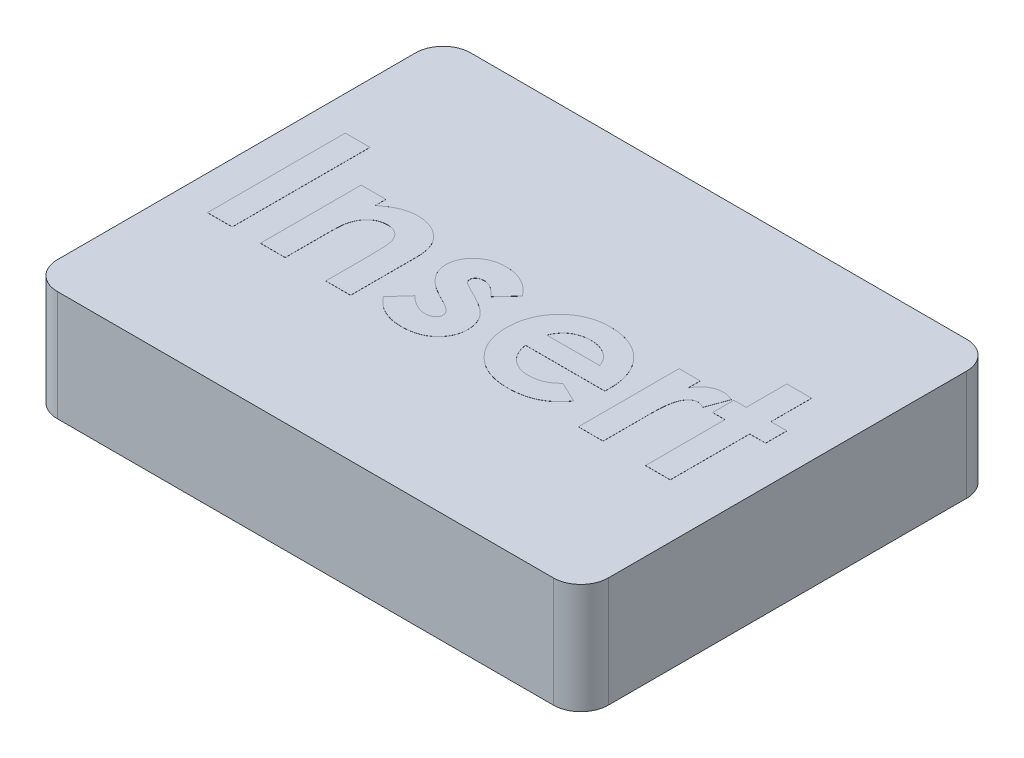
from build123d import *

# Parameters (mm, degrees)
SKETCH1_W           = 12.7
SKETCH1_H           = 9.525
BOSS_EXTRUDE1_DEPTH = 2.54
FILLET1_R           = 0.635
SHELL1_START        = 0.635
SHELL1_OUTLINE_W    = 1.905
SHELL1_OUTLINE_H    = 8.255
SHELL1_DEPTH        = 11.43
SKETCH2_R           = 2.54
BOSS_EXTRUDE2_DEPTH = 1.905
SKETCH3_W           = 0.569871795
SKETCH3_H           = 3.175
BOSS_EXTRUDE3_DEPTH = 0.00254


# Read off the part's stored shape, not the designer's step: Shell1
with BuildPart() as part:
    # Sketch1 → Boss-Extrude1 (new body)
    with BuildSketch(Plane(origin=(0, 0, 0), x_dir=(1, 0, 0), z_dir=(0, 1, 0))):
        with Locations((6.35, 4.7625)):
            Rectangle(SKETCH1_W, SKETCH1_H)
    extrude(amount=BOSS_EXTRUDE1_DEPTH)

    # Fillet1
    fillet1_edges = [part.edges().sort_by_distance(p)[0] for p in [
        (0, 1.27, -9.525),
        (12.7, 1.27, -9.525),
        (12.7, 1.27, 0),
        (0, 1.27, 0),
    ]]
    fillet(fillet1_edges, radius=FILLET1_R)

    # Shell1 outline → Shell1 (cut)
    with BuildSketch(Plane.YZ.offset(SHELL1_START)):
        with Locations((0.9525, -4.7625)):
            Rectangle(SHELL1_OUTLINE_W, SHELL1_OUTLINE_H)
    extrude(amount=SHELL1_DEPTH, mode=Mode.SUBTRACT)

    # Sketch2 → Boss-Extrude2 (add)
    with BuildSketch(Plane(origin=(0, 1.905, 0), x_dir=(-1, 0, 0), z_dir=(0, -1, 0))):
        with Locations(Location((-6.35, 4.7625, 0), (0, 0, 270))):
            Circle(SKETCH2_R)
    extrude(amount=BOSS_EXTRUDE2_DEPTH)

    # Sketch3 → Boss-Extrude3 (add)
    # profile 1 of 6: a face of its own
    with BuildSketch(Plane(origin=(0, 2.54, 0), x_dir=(1, 0, 0), z_dir=(0, 1, 0))):
        with Locations((1.077871795, 4.8895)):
            Rectangle(SKETCH3_W, SKETCH3_H)
    # profile 2 of 6: a face of its own
    with BuildSketch(Plane(origin=(0, 2.54, 0), x_dir=(1, 0, 0), z_dir=(0, 1, 0))):
        with BuildLine():
            Line((2.014089744, 5.622192308), (2.583961538, 5.622192308))
            Line((2.583961538, 5.622192308), (2.583961538, 5.376689503))
            add(Edge.make_bspline(
                [(2.583961538, 5.376689503), (2.616472442, 5.401977153), (2.678607098, 5.450306769), (2.773062504, 5.511927275), (2.862216712, 5.562361185), (2.948057066, 5.600723797), (3.032198654, 5.628324047), (3.11600421, 5.648153181), (3.200721768, 5.66085032), (3.25767253, 5.66221543), (3.286125, 5.662897436)],
                knots=[0, 0, 0, 0, 1.276643801, 2.439914479, 3.493451431, 4.44993799, 5.350072675, 6.235028322, 7.118224225, 8, 8, 8, 8], degree=3))
            add(Edge.make_bspline(
                [(3.286125, 5.662897436), (3.314986202, 5.662118044), (3.371643164, 5.660588033), (3.455067419, 5.649886845), (3.534771193, 5.630396591), (3.61165069, 5.604518806), (3.684923406, 5.570361613), (3.755486979, 5.529805489), (3.821825726, 5.480405385), (3.862680064, 5.442784638), (3.883345553, 5.423754808)],
                knots=[0, 0, 0, 0, 1.048836932, 2.058954983, 3.049370783, 4.026390553, 5.001981509, 5.982488534, 6.97947532, 8, 8, 8, 8], degree=3))
            add(Edge.make_bspline(
                [(3.883345553, 5.423754808), (3.899920035, 5.40611972), (3.933190306, 5.370720476), (3.975056761, 5.310143303), (4.010982889, 5.244103097), (4.040419359, 5.171838062), (4.062171724, 5.092951149), (4.078906115, 5.008395199), (4.088296074, 4.917696762), (4.089455309, 4.855387791), (4.090051282, 4.823354167)],
                knots=[0, 0, 0, 0, 0.889584746, 1.785680191, 2.700364693, 3.65222533, 4.649950538, 5.707241244, 6.821271309, 8, 8, 8, 8], degree=3))
            Line((4.090051282, 4.823354167), (4.090051282, 3.302))
            Line((4.090051282, 3.302), (3.520179487, 3.302))
            Line((3.520179487, 3.302), (3.520179487, 4.309451923))
            add(Edge.make_bspline(
                [(3.520179487, 4.309451923), (3.520058972, 4.34231325), (3.519828027, 4.405285883), (3.518054878, 4.495409185), (3.51459266, 4.57680223), (3.511436939, 4.649613213), (3.505241003, 4.713583603), (3.499653407, 4.769118384), (3.491079784, 4.815713739), (3.479924109, 4.865834035), (3.460443553, 4.919496978), (3.43020094, 4.976039753), (3.391833944, 5.024074101), (3.346909627, 5.063936766), (3.295477603, 5.095471791), (3.238159355, 5.117658645), (3.175262177, 5.131486038), (3.131436162, 5.132963488), (3.108676082, 5.133730769)],
                knots=[0, 0, 0, 0, 1.49886392, 2.872294502, 4.110984203, 5.214877267, 6.195405875, 7.042225351, 7.75923308, 8.355011229, 9.382752534, 10.352059385, 11.267231453, 12.171456522, 13.078624015, 14.003401117, 14.963110155, 16, 16, 16, 16], degree=3))
            add(Edge.make_bspline(
                [(3.108676082, 5.133730769), (3.079075641, 5.132229723), (3.021171423, 5.129293385), (2.937424557, 5.107150715), (2.860504456, 5.069492551), (2.79103962, 5.017381225), (2.729691644, 4.953043335), (2.679163823, 4.876313021), (2.637720631, 4.789042165), (2.619899442, 4.725320264), (2.610674279, 4.692334535)],
                knots=[0, 0, 0, 0, 0.984188326, 1.925263693, 2.85911992, 3.81709677, 4.80007086, 5.801799564, 6.862098548, 8, 8, 8, 8], degree=3))
            add(Edge.make_bspline(
                [(2.610674279, 4.692334535), (2.608381459, 4.681975146), (2.603268011, 4.658871626), (2.599062847, 4.619840753), (2.593213158, 4.573534401), (2.591021423, 4.519114556), (2.587210238, 4.456838765), (2.585800679, 4.386624637), (2.584388599, 4.30860985), (2.584108608, 4.254119486), (2.583961538, 4.225497596)],
                knots=[0, 0, 0, 0, 0.543362196, 1.211806945, 2.009705693, 2.934833164, 4.000995085, 5.207458376, 6.533175157, 8, 8, 8, 8], degree=3))
            Line((2.583961538, 4.225497596), (2.583961538, 3.302))
            Line((2.583961538, 3.302), (2.014089744, 3.302))
            Line((2.014089744, 3.302), (2.014089744, 5.622192308))
        make_face()
    # profile 3 of 6: a face of its own
    with BuildSketch(Plane(origin=(0, 2.54, 0), x_dir=(1, 0, 0), z_dir=(0, 1, 0))):
        with BuildLine():
            Line((6.084602564, 5.264114383), (5.736064904, 4.8895))
            add(Edge.make_bspline(
                [(5.736064904, 4.8895), (5.718660749, 4.908758641), (5.685373193, 4.945593127), (5.634413162, 4.995806763), (5.584212025, 5.037619888), (5.535705277, 5.072744656), (5.487902237, 5.099681155), (5.441200254, 5.119061362), (5.395576923, 5.131364206), (5.36533585, 5.132956762), (5.350638221, 5.133730769)],
                knots=[0, 0, 0, 0, 1.327646587, 2.539285, 3.655602211, 4.666613517, 5.598770349, 6.454635452, 7.248928967, 8, 8, 8, 8], degree=3))
            add(Edge.make_bspline(
                [(5.350638221, 5.133730769), (5.335765698, 5.133277506), (5.307289441, 5.132409647), (5.267103063, 5.124965596), (5.231796641, 5.112078571), (5.201921155, 5.094512355), (5.177918661, 5.072872582), (5.161113395, 5.048117191), (5.149828505, 5.021016135), (5.148873876, 5.001765207), (5.148384615, 4.991898838)],
                knots=[0, 0, 0, 0, 1.295068245, 2.479652818, 3.543291146, 4.55379989, 5.481948265, 6.332409746, 7.145336708, 8, 8, 8, 8], degree=3))
            add(Edge.make_bspline(
                [(5.148384615, 4.991898838), (5.150042275, 4.976947025), (5.153481726, 4.945923748), (5.177105984, 4.909941376), (5.208362583, 4.883397917), (5.244392404, 4.858697704), (5.293186109, 4.831080222), (5.330202252, 4.812169724), (5.350638221, 4.801729567)],
                knots=[0, 0, 0, 0, 0.916701701, 1.902049539, 2.5493345, 3.440293453, 4.586830489, 6, 6, 6, 6], degree=3))
            Line((5.350638221, 4.801729567), (5.556707933, 4.697422676))
            add(Edge.make_bspline(
                [(5.556707933, 4.697422676), (5.58292394, 4.684111039), (5.633787919, 4.658283963), (5.705297908, 4.616608507), (5.771345675, 4.576213663), (5.830606319, 4.534814403), (5.883442555, 4.493129972), (5.929479088, 4.450748166), (5.969832537, 4.409012568), (6.014832298, 4.353056541), (6.059845564, 4.278527666), (6.097372647, 4.181606337), (6.121303212, 4.077824904), (6.123950854, 4.005993817), (6.125307692, 3.969182492)],
                knots=[0, 0, 0, 0, 1.076693506, 2.088987655, 3.030641824, 3.911722491, 4.735175175, 5.493635918, 6.202154166, 6.859459289, 8.120623445, 9.372284821, 10.653373066, 12, 12, 12, 12], degree=3))
            add(Edge.make_bspline(
                [(6.125307692, 3.969182492), (6.124490188, 3.944348007), (6.122890116, 3.895740329), (6.112774798, 3.824194462), (6.094605067, 3.756164935), (6.070693729, 3.690591305), (6.038485872, 3.628659341), (5.999383956, 3.57006882), (5.954005415, 3.51405048), (5.901150601, 3.462520598), (5.843249036, 3.414495312), (5.778881675, 3.374102598), (5.710894564, 3.338588119), (5.637491589, 3.310854473), (5.559702687, 3.288369854), (5.476861045, 3.272788577), (5.389247764, 3.26298288), (5.329252836, 3.261867095), (5.298484776, 3.261294872)],
                knots=[0, 0, 0, 0, 0.976600749, 1.911466839, 2.833459288, 3.740827163, 4.650527853, 5.570709661, 6.506801416, 7.479409329, 8.468875524, 9.458587492, 10.461481786, 11.480119772, 12.538142914, 13.641687514, 14.790552763, 16, 16, 16, 16], degree=3))
            add(Edge.make_bspline(
                [(5.298484776, 3.261294872), (5.257719739, 3.262593012), (5.17770156, 3.265141146), (5.060840804, 3.282891086), (4.950493226, 3.313616532), (4.84656804, 3.356658951), (4.748428719, 3.411506792), (4.657476804, 3.479560957), (4.572135559, 3.559048346), (4.522483136, 3.620011473), (4.497102564, 3.651173678)],
                knots=[0, 0, 0, 0, 1.056901255, 2.07460411, 3.05625841, 4.019970729, 4.984811261, 5.963335951, 6.958928997, 8, 8, 8, 8], degree=3))
            Line((4.497102564, 3.651173678), (4.842460136, 4.034692308))
            add(Edge.make_bspline(
                [(4.842460136, 4.034692308), (4.859287123, 4.016944163), (4.892694196, 3.981708292), (4.949005021, 3.935245032), (5.008585862, 3.892897189), (5.072099997, 3.857338818), (5.135626965, 3.828627034), (5.196575849, 3.807089179), (5.253798001, 3.793554091), (5.291002369, 3.791456934), (5.308661058, 3.790461538)],
                knots=[0, 0, 0, 0, 1.087861918, 2.159761696, 3.243809206, 4.338405912, 5.394481878, 6.343674753, 7.213841449, 8, 8, 8, 8], degree=3))
            add(Edge.make_bspline(
                [(5.308661058, 3.790461538), (5.326310188, 3.790972669), (5.360236687, 3.791955203), (5.408455028, 3.802175487), (5.451193165, 3.819357293), (5.487436696, 3.843180303), (5.517583096, 3.87052548), (5.538824526, 3.901603435), (5.552870485, 3.934557895), (5.554577607, 3.9575984), (5.555435897, 3.969182492)],
                knots=[0, 0, 0, 0, 1.255011871, 2.412479185, 3.488767498, 4.514443302, 5.48617286, 6.365347346, 7.178144445, 8, 8, 8, 8], degree=3))
            add(Edge.make_bspline(
                [(5.555435897, 3.969182492), (5.554670047, 3.980091353), (5.55309761, 4.002489349), (5.54064857, 4.035550392), (5.521103332, 4.06828613), (5.493995154, 4.100788859), (5.458963327, 4.132794859), (5.41613322, 4.164047771), (5.366492926, 4.196214977), (5.329825779, 4.215414491), (5.310569111, 4.225497596)],
                knots=[0, 0, 0, 0, 0.704666567, 1.446816302, 2.258757648, 3.165368109, 4.175243826, 5.322435858, 6.59381024, 8, 8, 8, 8], degree=3))
            Line((5.310569111, 4.225497596), (5.121671875, 4.32090024))
            add(Edge.make_bspline(
                [(5.121671875, 4.32090024), (5.078822441, 4.343877821), (4.996567594, 4.387986161), (4.885389789, 4.463622589), (4.791293828, 4.544139073), (4.714203029, 4.62910305), (4.652776928, 4.71827609), (4.609928102, 4.812793541), (4.582972276, 4.911759356), (4.580006704, 4.979433254), (4.578512821, 5.013523437)],
                knots=[0, 0, 0, 0, 1.255999728, 2.41104856, 3.467751088, 4.449286722, 5.368722015, 6.253902015, 7.120417131, 8, 8, 8, 8], degree=3))
            add(Edge.make_bspline(
                [(4.578512821, 5.013523437), (4.579030887, 5.035617491), (4.580047935, 5.078991706), (4.590875024, 5.142689748), (4.607232433, 5.20391976), (4.630314498, 5.262778979), (4.659882221, 5.319325811), (4.696107812, 5.373309305), (4.739433218, 5.424631319), (4.788471412, 5.473126533), (4.842880828, 5.517293212), (4.901106904, 5.556435217), (4.962977421, 5.589776928), (5.029000139, 5.616359311), (5.098335876, 5.637517234), (5.171442321, 5.65189888), (5.248007567, 5.661045658), (5.300365985, 5.662271431), (5.327105569, 5.662897436)],
                knots=[0, 0, 0, 0, 0.959035663, 1.882742823, 2.798841253, 3.708806893, 4.623422363, 5.566085165, 6.527241613, 7.536786942, 8.55815439, 9.567237405, 10.580975912, 11.605536372, 12.654523293, 13.725718749, 14.838518481, 16, 16, 16, 16], degree=3))
            add(Edge.make_bspline(
                [(5.327105569, 5.662897436), (5.364073217, 5.661680308), (5.437447476, 5.659264525), (5.545660078, 5.639715992), (5.650182227, 5.60685942), (5.750720899, 5.561588559), (5.845982851, 5.504695952), (5.933873229, 5.435609112), (6.014986843, 5.356029271), (6.061166891, 5.295056923), (6.084602564, 5.264114383)],
                knots=[0, 0, 0, 0, 0.996590028, 1.978055413, 2.954661574, 3.945146934, 4.945404762, 5.939399542, 6.954276554, 8, 8, 8, 8], degree=3))
        make_face()
    # profile 4 of 6: a face of its own
    with BuildSketch(Plane(origin=(0, 2.54, 0), x_dir=(1, 0, 0), z_dir=(0, 1, 0))):
        with BuildLine():
            Line((8.932053486, 4.319628205), (7.102230769, 4.319628205))
            add(Edge.make_bspline(
                [(7.102230769, 4.319628205), (7.10596163, 4.298366703), (7.113293066, 4.256586175), (7.129213539, 4.195896331), (7.149530451, 4.138703248), (7.17387899, 4.08493047), (7.201848641, 4.034293723), (7.234472921, 3.987030513), (7.271338021, 3.943182585), (7.312230798, 3.902940508), (7.356469642, 3.866882735), (7.403840013, 3.835293846), (7.454390792, 3.80939289), (7.507542434, 3.787561071), (7.563692105, 3.770268059), (7.622922443, 3.758341398), (7.685076437, 3.751296275), (7.727417636, 3.750277279), (7.749060697, 3.74975641)],
                knots=[0, 0, 0, 0, 1.091296461, 2.144483647, 3.168565212, 4.157007626, 5.126487748, 6.090021542, 7.05641414, 8.019231907, 8.98705074, 9.938580405, 10.892824166, 11.854447369, 12.841318655, 13.858982407, 14.905600794, 16, 16, 16, 16], degree=3))
            add(Edge.make_bspline(
                [(7.749060697, 3.74975641), (7.775185341, 3.750446126), (7.826632459, 3.75180438), (7.90200287, 3.763850072), (7.974897036, 3.78204456), (8.044625122, 3.809101292), (8.111994818, 3.842782167), (8.175897012, 3.884744392), (8.237437801, 3.933761696), (8.274984935, 3.971544214), (8.294127804, 3.990807091)],
                knots=[0, 0, 0, 0, 1.021034703, 2.010718019, 2.977989445, 3.954245119, 4.929443971, 5.918328161, 6.938689359, 8, 8, 8, 8], degree=3))
            Line((8.294127804, 3.990807091), (8.771141026, 3.763748798))
            add(Edge.make_bspline(
                [(8.771141026, 3.763748798), (8.756122543, 3.74299556), (8.726363971, 3.701873781), (8.677784102, 3.644004818), (8.627087915, 3.590010728), (8.574237601, 3.540246638), (8.519166133, 3.494854357), (8.462026706, 3.453280923), (8.401984251, 3.416642568), (8.340239306, 3.38316675), (8.275515489, 3.354468086), (8.207991919, 3.329994878), (8.137954596, 3.307871307), (8.0645191, 3.291014358), (7.988296929, 3.277670534), (7.909105742, 3.268194651), (7.826955979, 3.262341853), (7.771119263, 3.261648011), (7.742700521, 3.261294872)],
                knots=[0, 0, 0, 0, 1.028154879, 2.037251081, 3.030720504, 4.000128189, 4.949298328, 5.894184978, 6.834267904, 7.770992897, 8.712077017, 9.673380525, 10.653304757, 11.658697181, 12.695551717, 13.758623199, 14.859225354, 16, 16, 16, 16], degree=3))
            add(Edge.make_bspline(
                [(7.742700521, 3.261294872), (7.698978753, 3.262186227), (7.613352189, 3.263931895), (7.488107861, 3.280134193), (7.369160488, 3.306999348), (7.256174202, 3.343518401), (7.149637407, 3.391734992), (7.049497377, 3.450707882), (6.95475357, 3.519306444), (6.868300938, 3.598970377), (6.78954004, 3.685679833), (6.720361364, 3.778799867), (6.662473632, 3.877679886), (6.614935063, 3.98166548), (6.577986436, 4.091022811), (6.551348619, 4.205799602), (6.535019318, 4.325941033), (6.533255672, 4.407770758), (6.532358974, 4.449375801)],
                knots=[0, 0, 0, 0, 1.103565453, 2.161269334, 3.182010356, 4.179077853, 5.15417608, 6.128274628, 7.109042802, 8.101804412, 9.090965879, 10.063106201, 11.02526161, 11.978650795, 12.945248442, 13.93468508, 14.949922959, 16, 16, 16, 16], degree=3))
            add(Edge.make_bspline(
                [(6.532358974, 4.449375801), (6.533264498, 4.492038082), (6.535046074, 4.575974203), (6.551208024, 4.698889754), (6.578060081, 4.816167815), (6.615116791, 4.92796989), (6.661934194, 5.034645647), (6.720558447, 5.135261803), (6.78950571, 5.230168647), (6.867982874, 5.318922196), (6.954801746, 5.39903197), (7.047055, 5.470425789), (7.145779196, 5.529915857), (7.249857678, 5.577983795), (7.358624723, 5.617037782), (7.473337525, 5.643024948), (7.593123295, 5.660473775), (7.67500621, 5.662080703), (7.716623798, 5.662897436)],
                knots=[0, 0, 0, 0, 1.079208495, 2.12329425, 3.130605359, 4.119693003, 5.099659317, 6.073216462, 7.060498243, 8.06384408, 9.066070512, 10.045757761, 11.010926815, 11.975797609, 12.942977511, 13.929384301, 14.947594487, 16, 16, 16, 16], degree=3))
            add(Edge.make_bspline(
                [(7.716623798, 5.662897436), (7.760555023, 5.661992252), (7.846809457, 5.660215016), (7.972926073, 5.644144278), (8.092663242, 5.617115301), (8.206531113, 5.580912022), (8.313075546, 5.531477429), (8.414637646, 5.473955769), (8.508781376, 5.403874397), (8.596510209, 5.324600313), (8.67570341, 5.236648465), (8.744927042, 5.141105819), (8.803827834, 5.038904817), (8.85156751, 4.929631011), (8.888478198, 4.813612453), (8.915140673, 4.690999814), (8.93134542, 4.561326736), (8.933076248, 4.472532148), (8.933961538, 4.427115184)],
                knots=[0, 0, 0, 0, 1.080001299, 2.120471247, 3.119684163, 4.095710327, 5.052285597, 6.002875087, 6.961153713, 7.931888285, 8.906493152, 9.865905668, 10.82813294, 11.801621613, 12.7925306, 13.817193356, 14.883530496, 16, 16, 16, 16], degree=3))
            Line((8.933961538, 4.427115184), (8.932053486, 4.319628205))
        make_face()
        with BuildLine():
            add(Edge.make_bspline(
                [(8.364089744, 4.767384615), (8.353335914, 4.796404845), (8.3319545, 4.85410462), (8.283654776, 4.933716231), (8.219562587, 5.002663119), (8.145018773, 5.063702347), (8.059847798, 5.113245596), (7.966733549, 5.149116518), (7.866852971, 5.170625172), (7.798140516, 5.17314776), (7.763053085, 5.174435897)],
                knots=[0, 0, 0, 0, 0.954238005, 1.897273737, 2.851915805, 3.847685534, 4.862635127, 5.880135777, 6.917509367, 8, 8, 8, 8], degree=3))
            add(Edge.make_bspline(
                [(7.763053085, 5.174435897), (7.724731898, 5.173198484), (7.649821956, 5.170779599), (7.541769466, 5.145053869), (7.439846255, 5.106658984), (7.379758107, 5.067073043), (7.349641627, 5.047232372)],
                knots=[0, 0, 0, 0, 1.044195649, 2.041185066, 3.018232172, 4, 4, 4, 4], degree=3))
            add(Edge.make_bspline(
                [(7.349641627, 5.047232372), (7.330851192, 5.032121282), (7.290790947, 4.999905211), (7.238764591, 4.935637207), (7.187518198, 4.857823082), (7.158381797, 4.798717757), (7.142935897, 4.767384615)],
                knots=[0, 0, 0, 0, 0.82159062, 1.751589201, 2.808063854, 4, 4, 4, 4], degree=3))
            Line((7.142935897, 4.767384615), (8.364089744, 4.767384615))
        make_face(mode=Mode.SUBTRACT)
    # profile 5 of 6: a face of its own
    with BuildSketch(Plane(origin=(0, 2.54, 0), x_dir=(1, 0, 0), z_dir=(0, 1, 0))):
        with BuildLine():
            Line((9.341012821, 5.622192308), (9.829474359, 5.622192308))
            Line((9.829474359, 5.622192308), (9.829474359, 5.336620393))
            add(Edge.make_bspline(
                [(9.829474359, 5.336620393), (9.843291998, 5.361999247), (9.870299147, 5.411603272), (9.919913545, 5.478186851), (9.976912575, 5.534261684), (10.039248085, 5.581000626), (10.107109003, 5.617429043), (10.178678133, 5.643388882), (10.253343204, 5.66025918), (10.304277183, 5.662011685), (10.330020232, 5.662897436)],
                knots=[0, 0, 0, 0, 1.09866127, 2.147379032, 3.14564304, 4.131443017, 5.102343063, 6.064490016, 7.021754664, 8, 8, 8, 8], degree=3))
            add(Edge.make_bspline(
                [(10.330020232, 5.662897436), (10.348712898, 5.662022129), (10.38677784, 5.660239691), (10.444794169, 5.649878355), (10.503647571, 5.631143087), (10.542378181, 5.614274469), (10.562166667, 5.605655849)],
                knots=[0, 0, 0, 0, 0.931404136, 1.896671404, 2.925354185, 4, 4, 4, 4], degree=3))
            Line((10.562166667, 5.605655849), (10.385353766, 5.12291847))
            add(Edge.make_bspline(
                [(10.385353766, 5.12291847), (10.369549218, 5.130554463), (10.339842751, 5.144907192), (10.296714118, 5.16184489), (10.257573097, 5.172179446), (10.232758407, 5.173721452), (10.221261218, 5.174435897)],
                knots=[0, 0, 0, 0, 1.214386998, 2.282580073, 3.20428172, 4, 4, 4, 4], degree=3))
            add(Edge.make_bspline(
                [(10.221261218, 5.174435897), (10.210405635, 5.173962468), (10.189050834, 5.173031151), (10.157531745, 5.165050083), (10.127847327, 5.151286977), (10.098567088, 5.133655073), (10.072000916, 5.109145407), (10.045451154, 5.080771118), (10.022054081, 5.045739283), (9.997363384, 5.006747072), (9.976340139, 4.959020641), (9.958313353, 4.902045117), (9.942251343, 4.835161255), (9.931198486, 4.758013934), (9.920515457, 4.671349687), (9.914156655, 4.574532411), (9.90941736, 4.467868249), (9.909127584, 4.393412815), (9.908976562, 4.354609175)],
                knots=[0, 0, 0, 0, 0.544232178, 1.070598461, 1.618251235, 2.182094276, 2.777567932, 3.425210017, 4.127676488, 4.886675562, 5.738955394, 6.734782583, 7.883056018, 9.186093582, 10.642914445, 12.264202625, 14.053029461, 16, 16, 16, 16], degree=3))
            Line((9.908976562, 4.354609175), (9.910884615, 4.241398037))
            Line((9.910884615, 4.241398037), (9.910884615, 3.302))
            Line((9.910884615, 3.302), (9.341012821, 3.302))
            Line((9.341012821, 3.302), (9.341012821, 5.622192308))
        make_face()
    # profile 6 of 6: a face of its own
    with BuildSketch(Plane(origin=(0, 2.54, 0), x_dir=(1, 0, 0), z_dir=(0, 1, 0))):
        Polygon((10.887807692, 6.558410256), (11.457679487, 6.558410256), (11.457679487, 5.622192308), (11.824025641, 5.622192308), (11.824025641, 5.133730769), (11.457679487, 5.133730769), (11.457679487, 3.302), (10.887807692, 3.302), (10.887807692, 5.133730769), (10.602871795, 5.133730769), (10.602871795, 5.622192308), (10.887807692, 5.622192308), align=None)
    extrude(amount=BOSS_EXTRUDE3_DEPTH)


solid = part.part
